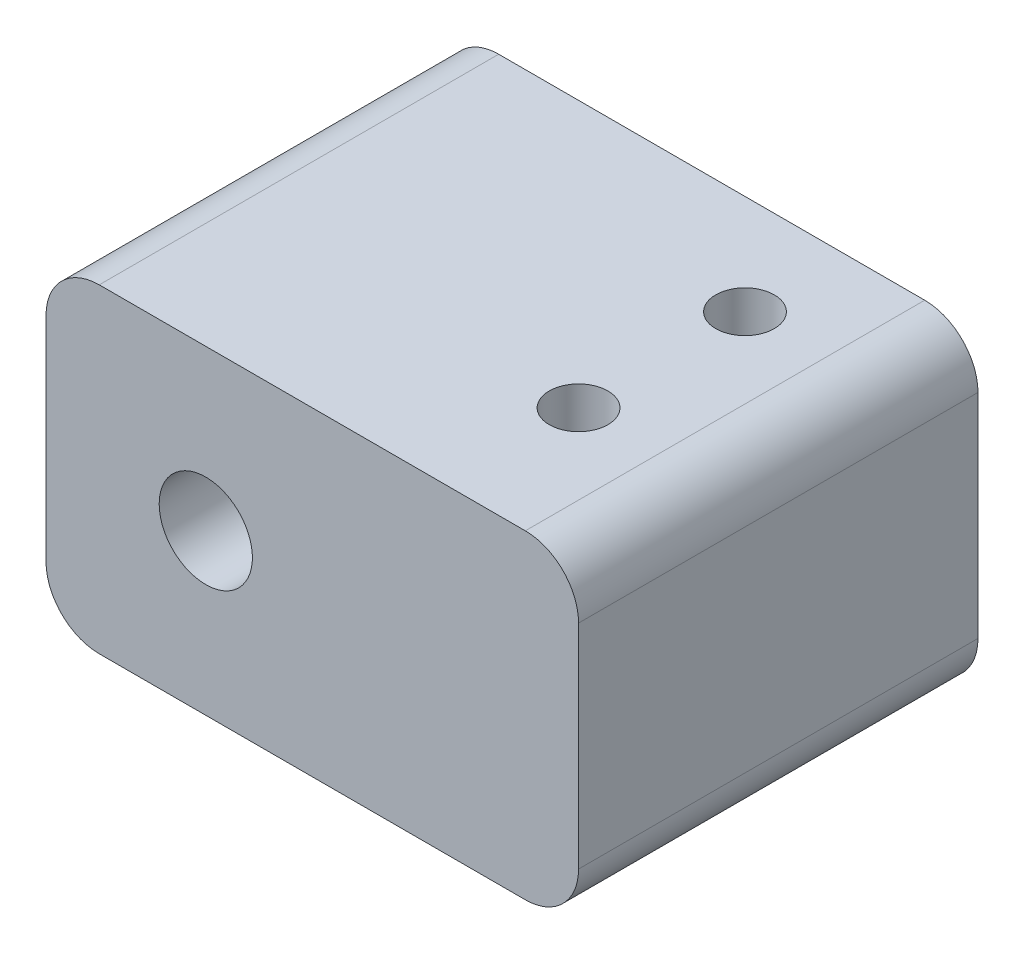
from build123d import *

# Parameters (mm, degrees)
SKETCH1_R               = 4.5
SKETCH1_R_2             = 1.25
BOSS_EXTRUDE1_DEPTH     = 8
SKETCH2_R               = 1.75
SKETCH2_R_2             = 1.25
CUT_EXTRUDE1_DEPTH      = 4
SKETCH4_W               = 12
SKETCH4_H               = 12
SKETCH4_W_2             = 6.5
SKETCH4_H_2             = 6.5
BOSS_EXTRUDE2_DEPTH     = 15
SKETCH5_W               = 15
SKETCH5_H               = 12
BOSS_EXTRUDE3_DEPTH     = 8
CUT_EXTRUDE2_DEPTH      = 24.769728648
CUT_EXTRUDE2_DEPTH_BACK = 24.769728648
SKETCH6_R               = 1.1
FILLET1_R               = 2
SKETCH1_2_R             = 4.5
SKETCH1_2_R_2           = 1.25
CUT_EXTRUDE5_DEPTH      = 8
BOSS_EXTRUDE5_OUTLINE_W = 6.5
BOSS_EXTRUDE5_OUTLINE_H = 6.5
BOSS_EXTRUDE5_OUTLINE_R = 1.75
BOSS_EXTRUDE5_DEPTH     = 3


# Read off the part's stored shape, not the designer's step: Boss-Extrude5
with BuildPart() as part:
    # Sketch1 → Boss-Extrude1 (new body)
    with BuildSketch(Plane.XY):
        Circle(SKETCH1_R)
        Circle(SKETCH1_R_2, mode=Mode.SUBTRACT)
    extrude(amount=BOSS_EXTRUDE1_DEPTH)

    # Sketch2 → Cut-Extrude1 (cut)
    with BuildSketch(Plane(origin=(0, 0, 0), x_dir=(-1, 0, 0), z_dir=(0, 0, -1))):
        Circle(SKETCH2_R)
        Circle(SKETCH2_R_2, mode=Mode.SUBTRACT)
    extrude(amount=-CUT_EXTRUDE1_DEPTH, mode=Mode.SUBTRACT)

    # Sketch4 → Boss-Extrude2 (add)
    with BuildSketch(Plane(origin=(0, 0, 0), x_dir=(-1, 0, 0), z_dir=(0, 0, -1))):
        Rectangle(SKETCH4_W, SKETCH4_H)
        Rectangle(SKETCH4_W_2, SKETCH4_H_2, mode=Mode.SUBTRACT)
    extrude(amount=BOSS_EXTRUDE2_DEPTH)

    # Sketch5 → Boss-Extrude3 (add)
    with BuildSketch(Plane(origin=(6, 0, 0), x_dir=(0, 0, -1), z_dir=(1, 0, 0))):
        with Locations((7.5, 0)):
            Rectangle(SKETCH5_W, SKETCH5_H)
    extrude(amount=BOSS_EXTRUDE3_DEPTH)

    # Sketch6 → Cut-Extrude2 (cut, two sides: drawn at the far end of the back side and taken through both)
    with BuildSketch(Plane(origin=(0, 6, 0), x_dir=(1, 0, 0), z_dir=(0, 1, 0)).offset(-CUT_EXTRUDE2_DEPTH_BACK)):
        with Locations(Location((9, 11.25, 0), (0, 0, 270))):
            Circle(SKETCH6_R)
        with Locations(Location((9, 5, 0), (0, 0, 270))):
            Circle(SKETCH6_R)
    extrude(amount=CUT_EXTRUDE2_DEPTH + CUT_EXTRUDE2_DEPTH_BACK, mode=Mode.SUBTRACT)

    # Fillet1
    fillet1_edges = [part.edges().sort_by_distance(p)[0] for p in [
        (-6, -6, -7.5),
        (-6, 6, -7.5),
        (14, 6, -7.5),
        (14, -6, -7.5),
    ]]
    fillet(fillet1_edges, radius=FILLET1_R)

    # Sketch1<2> → Cut-Extrude5 (cut)
    with BuildSketch(Plane.XY):
        Circle(SKETCH1_2_R)
        Circle(SKETCH1_2_R_2, mode=Mode.SUBTRACT)
    extrude(amount=CUT_EXTRUDE5_DEPTH, mode=Mode.SUBTRACT)

    # Boss-Extrude5 outline → Boss-Extrude5 (add)
    with BuildSketch(Plane(origin=(0, 0, 0), x_dir=(-1, 0, 0), z_dir=(0, 0, -1))):
        Rectangle(BOSS_EXTRUDE5_OUTLINE_W, BOSS_EXTRUDE5_OUTLINE_H)
        Circle(BOSS_EXTRUDE5_OUTLINE_R, mode=Mode.SUBTRACT)
    extrude(amount=BOSS_EXTRUDE5_DEPTH)


solid = part.part
